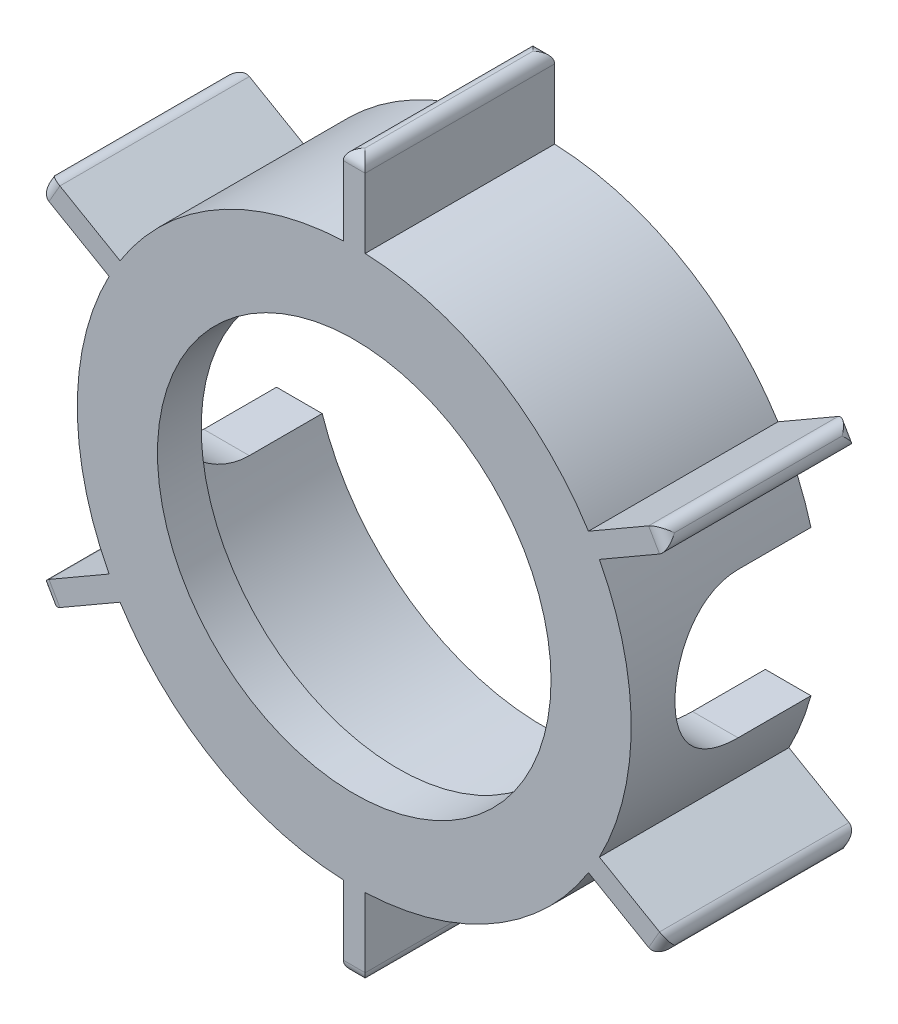
from build123d import *

# Parameters (mm, degrees)
CONTOUR_R                                    = 19
BOSS_EXTRU_1_CONTOUR_DEPTH                   = 13
COQUE1_T                                     = -3
ENL_V_MAT_EXTRU_1_OUVERTUE_AIMANT_REACH      = 46.43
ENL_V_MAT_EXTRU_1_OUVERTUE_AIMANT_END_RADIUS = 16
ENL_V_MAT_EXTRU_2_OUVERTURE_CROU_REACH       = 31.85
OUVERTURE_CROU_R                             = 13.5
BOSS_EXTRU_2_AILETTES_REACH                  = 51.216
BOSS_EXTRU_2_AILETTES_END_RADIUS             = 19
AILETTES_W                                   = 1.5
AILETTES_H                                   = 13
R_P_TITION_CIRCULAIRE4_AILETTES_COUNT        = 6
CONG_1_AILETTES_R                            = 0.75


with BuildPart() as part:
    # Contour → Boss.-Extru.1_Contour (new body)
    with BuildSketch(Plane.XY):
        with Locations(Location((0, 0, 0), (0, 0, 180))):
            Circle(CONTOUR_R)
    extrude(amount=BOSS_EXTRU_1_CONTOUR_DEPTH)

    # Coque1
    coque1_openings = [part.faces().sort_by_distance(p)[0] for p in [
        (0, 0, 0),
    ]]
    offset(amount=COQUE1_T, openings=coque1_openings, kind=Kind.INTERSECTION)

    # Enlèv. mat.-Extru.1_Ouvertue_aimant: up to this cylinder (the profile starts outside it)
    enl_v_mat_extru_1_ouvertue_aimant_end = Plane(origin=(0, 0, 4.533251), z_dir=(0, 0, -1)) * Cylinder(ENL_V_MAT_EXTRU_1_OUVERTUE_AIMANT_END_RADIUS, 125.86, mode=Mode.PRIVATE)
    # Ouvertue_aimant → Enlèv. mat.-Extru.1_Ouvertue_aimant (cut, up to the surface)
    with BuildSketch(Plane(origin=(19, 0, 0), x_dir=(0, 0, -1), z_dir=(1, 0, 0)), mode=Mode.PRIVATE) as enl_v_mat_extru_1_ouvertue_aimant_sk1:
        with BuildLine():
            Line((0, 5), (-5, 5))
            ThreePointArc((-5, 5), (-10, 0), (-5, -5))
            Line((-5, -5), (0, -5))
            Line((0, -5), (0, 5))
        make_face()
    enl_v_mat_extru_1_ouvertue_aimant_tool1 = extrude(enl_v_mat_extru_1_ouvertue_aimant_sk1.sketch, amount=-ENL_V_MAT_EXTRU_1_OUVERTUE_AIMANT_REACH, mode=Mode.PRIVATE) - enl_v_mat_extru_1_ouvertue_aimant_end
    enl_v_mat_extru_1_ouvertue_aimant = enl_v_mat_extru_1_ouvertue_aimant_tool1.solids().sort_by_distance((19, 0, 4.533251))[0]
    add(enl_v_mat_extru_1_ouvertue_aimant, mode=Mode.SUBTRACT)

    # Symétrie1_Ouvertue_aimant: Enlèv. mat.-Extru.1_Ouvertue_aimant across plane
    add(enl_v_mat_extru_1_ouvertue_aimant.mirror(Plane(origin=(0, 0, 0), x_dir=(0, 0, 1), z_dir=(1, 0, 0))), mode=Mode.SUBTRACT)

    # Ouverture_Écrou → Enlèv. mat.-Extru.2_Ouverture_Écrou (cut, up to next)
    with BuildSketch(Plane.XY.offset(13), mode=Mode.PRIVATE) as enl_v_mat_extru_2_ouverture_crou_sk1:
        Circle(OUVERTURE_CROU_R)
    enl_v_mat_extru_2_ouverture_crou_tool1 = extrude(enl_v_mat_extru_2_ouverture_crou_sk1.sketch, amount=-ENL_V_MAT_EXTRU_2_OUVERTURE_CROU_REACH, mode=Mode.PRIVATE) & part.part
    add(enl_v_mat_extru_2_ouverture_crou_tool1.solids().sort_by_distance((0, 0, 13))[0], mode=Mode.SUBTRACT)

    # Boss.-Extru.2_Ailettes: up to this cylinder (the profile starts outside it)
    boss_extru_2_ailettes_end = Plane(origin=(0, 0, 6.5), z_dir=(0, 0, -1)) * Cylinder(BOSS_EXTRU_2_AILETTES_END_RADIUS, 141.432, mode=Mode.PRIVATE)
    # Ailettes → Boss.-Extru.2_Ailettes (add, up to the surface)
    with BuildSketch(Plane(origin=(0, 24.5, 0), x_dir=(1, 0, 0), z_dir=(0, 1, 0)), mode=Mode.PRIVATE) as boss_extru_2_ailettes_sk1:
        with Locations((0, -6.5)):
            Rectangle(AILETTES_W, AILETTES_H)
    boss_extru_2_ailettes_tool1 = extrude(boss_extru_2_ailettes_sk1.sketch, amount=-BOSS_EXTRU_2_AILETTES_REACH, mode=Mode.PRIVATE) - boss_extru_2_ailettes_end
    boss_extru_2_ailettes = boss_extru_2_ailettes_tool1.solids().sort_by_distance((0, 24.5, 6.5))[0]
    add(boss_extru_2_ailettes)

    # Répétition circulaire4_Ailettes: Boss.-Extru.2_Ailettes ×6 about axis
    r_p_tition_circulaire4_ailettes_axis = Axis((0, 0, 0), (0, 0, 1))
    for i in range(1, R_P_TITION_CIRCULAIRE4_AILETTES_COUNT):
        add(boss_extru_2_ailettes.rotate(r_p_tition_circulaire4_ailettes_axis, i * 360 / R_P_TITION_CIRCULAIRE4_AILETTES_COUNT))

    # Congé1_Ailettes
    cong_1_ailettes_edges = [part.edges().sort_by_distance(p)[0] for p in [
        (-20.842622393, -12.899519053, 6.5),
        (-21.217622393, -12.25, 13),
        (-21.592622393, -11.600480947, 6.5),
        (-21.217622393, -12.25, 0),
        (-21.592622393, 11.600480947, 6.5),
        (-21.217622393, 12.25, 13),
        (-20.842622393, 12.899519053, 6.5),
        (-21.217622393, 12.25, 0),
        (-0.75, 24.5, 6.5),
        (0, 24.5, 13),
        (0.75, 24.5, 6.5),
        (0, 24.5, 0),
        (20.842622393, 12.899519053, 6.5),
        (21.217622393, 12.25, 13),
        (21.592622393, 11.600480947, 6.5),
        (21.217622393, 12.25, 0),
        (21.592622393, -11.600480947, 6.5),
        (21.217622393, -12.25, 13),
        (20.842622393, -12.899519053, 6.5),
        (21.217622393, -12.25, 0),
        (0.75, -24.5, 6.5),
        (0, -24.5, 13),
        (-0.75, -24.5, 6.5),
        (0, -24.5, 0),
    ]]
    fillet(cong_1_ailettes_edges, radius=CONG_1_AILETTES_R - 0.0001)  # a hair under: the kernel refuses the full size


solid = part.part
